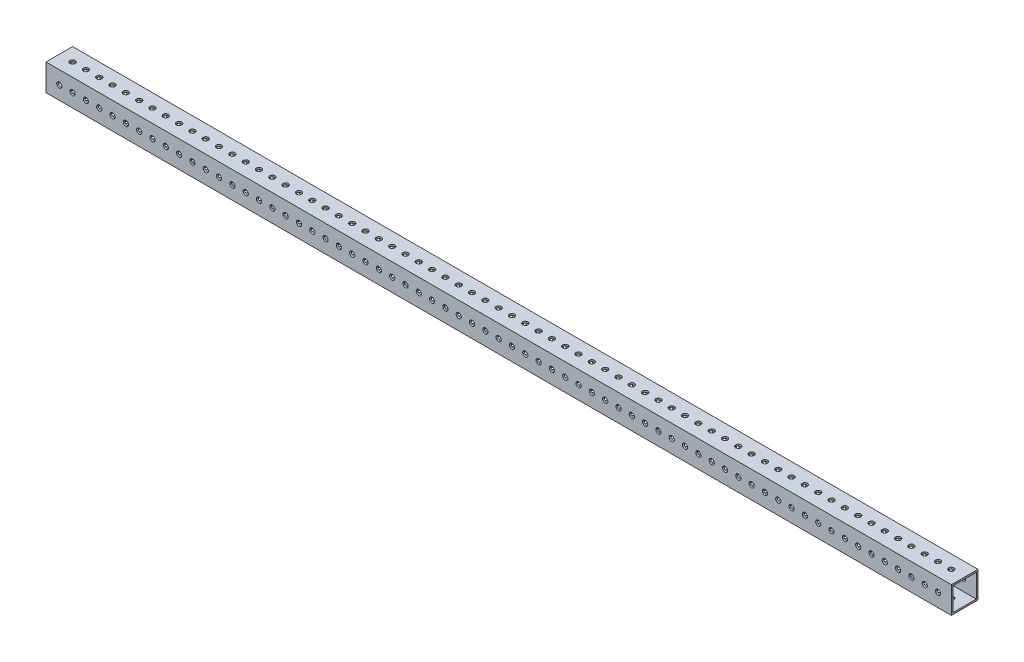
from build123d import *

# Parameters (mm, degrees)
SKETCH1_W             = 25.4
SKETCH1_H             = 25.4
SKETCH1_W_2           = 22.225
SKETCH1_H_2           = 22.225
BOSS_EXTRUDE1_DEPTH   = 431.8
SKETCH3_W             = 2.4892
SKETCH3_H             = 25.4
SKETCH3_AT_POINT_2_W  = 2.4892
SKETCH3_AT_POINT_2_H  = 25.4
LPATTERN1_START       = -12.7
LPATTERN1_OUTLINE_R   = 2.4892
LPATTERN1_DEPTH       = 25.4
LPATTERN1_2_OUTLINE_R = 2.4892
LPATTERN1_2_DEPTH     = 25.4


with BuildPart() as part:
    # Sketch1 → Boss-Extrude1 (new, symmetric)
    with BuildSketch(Plane(origin=(0, 0, 0), x_dir=(0, 0, -1), z_dir=(1, 0, 0))):
        Rectangle(SKETCH1_W, SKETCH1_H)
        Rectangle(SKETCH1_W_2, SKETCH1_H_2, mode=Mode.SUBTRACT)
    extrude(amount=BOSS_EXTRUDE1_DEPTH, both=True)

    # Sketch3 → #9 (0.196) Diameter Hole1 (revolve, cut)
    with BuildSketch(Plane(origin=(419.1, 12.7, 0), x_dir=(0, 0, 1), z_dir=(1, 0, 0))):
        with Locations((1.2446, 12.7)):
            Rectangle(SKETCH3_W, SKETCH3_H)
    revolve(axis=Axis((419.1, 19.05, 0), (0, -1, 0)), mode=Mode.SUBTRACT)

    # Sketch3 at point 2 (carried to point 2, square into its face) → #9 (0.196) Diameter Hole1 at 2 (revolve, cut)
    with BuildSketch(Plane(origin=(419.1, 0, 12.7), x_dir=(0, -1, 0), z_dir=(1, 0, 0))):
        with Locations((1.2446, 12.7)):
            Rectangle(SKETCH3_AT_POINT_2_W, SKETCH3_AT_POINT_2_H)
    revolve(axis=Axis((419.1, 0, 19.05), (0, 0, -1)), mode=Mode.SUBTRACT)

    # LPattern1: read off the stored shape, not the designer's step
    # LPattern1 outline → LPattern1 (cut)
    with BuildSketch(Plane.XY.offset(LPATTERN1_START)):
        with Locations((406.4, 0)):
            Circle(LPATTERN1_OUTLINE_R)
        with Locations((393.7, 0)):
            Circle(LPATTERN1_OUTLINE_R)
        with Locations((381, 0)):
            Circle(LPATTERN1_OUTLINE_R)
        with Locations((368.3, 0)):
            Circle(LPATTERN1_OUTLINE_R)
        with Locations((355.6, 0)):
            Circle(LPATTERN1_OUTLINE_R)
        with Locations((342.9, 0)):
            Circle(LPATTERN1_OUTLINE_R)
        with Locations((330.2, 0)):
            Circle(LPATTERN1_OUTLINE_R)
        with Locations((317.5, 0)):
            Circle(LPATTERN1_OUTLINE_R)
        with Locations((304.8, 0)):
            Circle(LPATTERN1_OUTLINE_R)
        with Locations((292.1, 0)):
            Circle(LPATTERN1_OUTLINE_R)
        with Locations((279.4, 0)):
            Circle(LPATTERN1_OUTLINE_R)
        with Locations((266.7, 0)):
            Circle(LPATTERN1_OUTLINE_R)
        with Locations((254, 0)):
            Circle(LPATTERN1_OUTLINE_R)
        with Locations((241.3, 0)):
            Circle(LPATTERN1_OUTLINE_R)
        with Locations((228.6, 0)):
            Circle(LPATTERN1_OUTLINE_R)
        with Locations((215.9, 0)):
            Circle(LPATTERN1_OUTLINE_R)
        with Locations((203.2, 0)):
            Circle(LPATTERN1_OUTLINE_R)
        with Locations((190.5, 0)):
            Circle(LPATTERN1_OUTLINE_R)
        with Locations((177.8, 0)):
            Circle(LPATTERN1_OUTLINE_R)
        with Locations((165.1, 0)):
            Circle(LPATTERN1_OUTLINE_R)
        with Locations((152.4, 0)):
            Circle(LPATTERN1_OUTLINE_R)
        with Locations((139.7, 0)):
            Circle(LPATTERN1_OUTLINE_R)
        with Locations((127, 0)):
            Circle(LPATTERN1_OUTLINE_R)
        with Locations((114.3, 0)):
            Circle(LPATTERN1_OUTLINE_R)
        with Locations((101.6, 0)):
            Circle(LPATTERN1_OUTLINE_R)
        with Locations((88.9, 0)):
            Circle(LPATTERN1_OUTLINE_R)
        with Locations((76.2, 0)):
            Circle(LPATTERN1_OUTLINE_R)
        with Locations((63.5, 0)):
            Circle(LPATTERN1_OUTLINE_R)
        with Locations((50.8, 0)):
            Circle(LPATTERN1_OUTLINE_R)
        with Locations((38.1, 0)):
            Circle(LPATTERN1_OUTLINE_R)
        with Locations((25.4, 0)):
            Circle(LPATTERN1_OUTLINE_R)
        with Locations((12.7, 0)):
            Circle(LPATTERN1_OUTLINE_R)
        Circle(LPATTERN1_OUTLINE_R)
        with Locations((-12.7, 0)):
            Circle(LPATTERN1_OUTLINE_R)
        with Locations((-25.4, 0)):
            Circle(LPATTERN1_OUTLINE_R)
        with Locations((-38.1, 0)):
            Circle(LPATTERN1_OUTLINE_R)
        with Locations((-50.8, 0)):
            Circle(LPATTERN1_OUTLINE_R)
        with Locations((-63.5, 0)):
            Circle(LPATTERN1_OUTLINE_R)
        with Locations((-76.2, 0)):
            Circle(LPATTERN1_OUTLINE_R)
        with Locations((-88.9, 0)):
            Circle(LPATTERN1_OUTLINE_R)
        with Locations((-101.6, 0)):
            Circle(LPATTERN1_OUTLINE_R)
        with Locations((-114.3, 0)):
            Circle(LPATTERN1_OUTLINE_R)
        with Locations((-127, 0)):
            Circle(LPATTERN1_OUTLINE_R)
        with Locations((-139.7, 0)):
            Circle(LPATTERN1_OUTLINE_R)
        with Locations((-152.4, 0)):
            Circle(LPATTERN1_OUTLINE_R)
        with Locations((-165.1, 0)):
            Circle(LPATTERN1_OUTLINE_R)
        with Locations((-177.8, 0)):
            Circle(LPATTERN1_OUTLINE_R)
        with Locations((-190.5, 0)):
            Circle(LPATTERN1_OUTLINE_R)
        with Locations((-203.2, 0)):
            Circle(LPATTERN1_OUTLINE_R)
        with Locations((-215.9, 0)):
            Circle(LPATTERN1_OUTLINE_R)
        with Locations((-228.6, 0)):
            Circle(LPATTERN1_OUTLINE_R)
        with Locations((-241.3, 0)):
            Circle(LPATTERN1_OUTLINE_R)
        with Locations((-254, 0)):
            Circle(LPATTERN1_OUTLINE_R)
        with Locations((-266.7, 0)):
            Circle(LPATTERN1_OUTLINE_R)
        with Locations((-279.4, 0)):
            Circle(LPATTERN1_OUTLINE_R)
        with Locations((-292.1, 0)):
            Circle(LPATTERN1_OUTLINE_R)
        with Locations((-304.8, 0)):
            Circle(LPATTERN1_OUTLINE_R)
        with Locations((-317.5, 0)):
            Circle(LPATTERN1_OUTLINE_R)
        with Locations((-330.2, 0)):
            Circle(LPATTERN1_OUTLINE_R)
        with Locations((-342.9, 0)):
            Circle(LPATTERN1_OUTLINE_R)
        with Locations((-355.6, 0)):
            Circle(LPATTERN1_OUTLINE_R)
        with Locations((-368.3, 0)):
            Circle(LPATTERN1_OUTLINE_R)
        with Locations((-381, 0)):
            Circle(LPATTERN1_OUTLINE_R)
        with Locations((-393.7, 0)):
            Circle(LPATTERN1_OUTLINE_R)
        with Locations((-406.4, 0)):
            Circle(LPATTERN1_OUTLINE_R)
        with Locations((-419.1, 0)):
            Circle(LPATTERN1_OUTLINE_R)
    extrude(amount=LPATTERN1_DEPTH, mode=Mode.SUBTRACT)

    # LPattern1 2 outline → LPattern1 2 (cut)
    with BuildSketch(Plane(origin=(0, 0, 0), x_dir=(1, 0, 0), z_dir=(0, 1, 0)).offset(LPATTERN1_START)):
        with Locations((406.4, 0)):
            Circle(LPATTERN1_2_OUTLINE_R)
        with Locations((393.7, 0)):
            Circle(LPATTERN1_2_OUTLINE_R)
        with Locations((381, 0)):
            Circle(LPATTERN1_2_OUTLINE_R)
        with Locations((368.3, 0)):
            Circle(LPATTERN1_2_OUTLINE_R)
        with Locations((355.6, 0)):
            Circle(LPATTERN1_2_OUTLINE_R)
        with Locations((342.9, 0)):
            Circle(LPATTERN1_2_OUTLINE_R)
        with Locations((330.2, 0)):
            Circle(LPATTERN1_2_OUTLINE_R)
        with Locations((317.5, 0)):
            Circle(LPATTERN1_2_OUTLINE_R)
        with Locations((304.8, 0)):
            Circle(LPATTERN1_2_OUTLINE_R)
        with Locations((292.1, 0)):
            Circle(LPATTERN1_2_OUTLINE_R)
        with Locations((279.4, 0)):
            Circle(LPATTERN1_2_OUTLINE_R)
        with Locations((266.7, 0)):
            Circle(LPATTERN1_2_OUTLINE_R)
        with Locations((254, 0)):
            Circle(LPATTERN1_2_OUTLINE_R)
        with Locations((241.3, 0)):
            Circle(LPATTERN1_2_OUTLINE_R)
        with Locations((228.6, 0)):
            Circle(LPATTERN1_2_OUTLINE_R)
        with Locations((215.9, 0)):
            Circle(LPATTERN1_2_OUTLINE_R)
        with Locations((203.2, 0)):
            Circle(LPATTERN1_2_OUTLINE_R)
        with Locations((190.5, 0)):
            Circle(LPATTERN1_2_OUTLINE_R)
        with Locations((177.8, 0)):
            Circle(LPATTERN1_2_OUTLINE_R)
        with Locations((165.1, 0)):
            Circle(LPATTERN1_2_OUTLINE_R)
        with Locations((152.4, 0)):
            Circle(LPATTERN1_2_OUTLINE_R)
        with Locations((139.7, 0)):
            Circle(LPATTERN1_2_OUTLINE_R)
        with Locations((127, 0)):
            Circle(LPATTERN1_2_OUTLINE_R)
        with Locations((114.3, 0)):
            Circle(LPATTERN1_2_OUTLINE_R)
        with Locations((101.6, 0)):
            Circle(LPATTERN1_2_OUTLINE_R)
        with Locations((88.9, 0)):
            Circle(LPATTERN1_2_OUTLINE_R)
        with Locations((76.2, 0)):
            Circle(LPATTERN1_2_OUTLINE_R)
        with Locations((63.5, 0)):
            Circle(LPATTERN1_2_OUTLINE_R)
        with Locations((50.8, 0)):
            Circle(LPATTERN1_2_OUTLINE_R)
        with Locations((38.1, 0)):
            Circle(LPATTERN1_2_OUTLINE_R)
        with Locations((25.4, 0)):
            Circle(LPATTERN1_2_OUTLINE_R)
        with Locations((12.7, 0)):
            Circle(LPATTERN1_2_OUTLINE_R)
        Circle(LPATTERN1_2_OUTLINE_R)
        with Locations((-12.7, 0)):
            Circle(LPATTERN1_2_OUTLINE_R)
        with Locations((-25.4, 0)):
            Circle(LPATTERN1_2_OUTLINE_R)
        with Locations((-38.1, 0)):
            Circle(LPATTERN1_2_OUTLINE_R)
        with Locations((-50.8, 0)):
            Circle(LPATTERN1_2_OUTLINE_R)
        with Locations((-63.5, 0)):
            Circle(LPATTERN1_2_OUTLINE_R)
        with Locations((-76.2, 0)):
            Circle(LPATTERN1_2_OUTLINE_R)
        with Locations((-88.9, 0)):
            Circle(LPATTERN1_2_OUTLINE_R)
        with Locations((-101.6, 0)):
            Circle(LPATTERN1_2_OUTLINE_R)
        with Locations((-114.3, 0)):
            Circle(LPATTERN1_2_OUTLINE_R)
        with Locations((-127, 0)):
            Circle(LPATTERN1_2_OUTLINE_R)
        with Locations((-139.7, 0)):
            Circle(LPATTERN1_2_OUTLINE_R)
        with Locations((-152.4, 0)):
            Circle(LPATTERN1_2_OUTLINE_R)
        with Locations((-165.1, 0)):
            Circle(LPATTERN1_2_OUTLINE_R)
        with Locations((-177.8, 0)):
            Circle(LPATTERN1_2_OUTLINE_R)
        with Locations((-190.5, 0)):
            Circle(LPATTERN1_2_OUTLINE_R)
        with Locations((-203.2, 0)):
            Circle(LPATTERN1_2_OUTLINE_R)
        with Locations((-215.9, 0)):
            Circle(LPATTERN1_2_OUTLINE_R)
        with Locations((-228.6, 0)):
            Circle(LPATTERN1_2_OUTLINE_R)
        with Locations((-241.3, 0)):
            Circle(LPATTERN1_2_OUTLINE_R)
        with Locations((-254, 0)):
            Circle(LPATTERN1_2_OUTLINE_R)
        with Locations((-266.7, 0)):
            Circle(LPATTERN1_2_OUTLINE_R)
        with Locations((-279.4, 0)):
            Circle(LPATTERN1_2_OUTLINE_R)
        with Locations((-292.1, 0)):
            Circle(LPATTERN1_2_OUTLINE_R)
        with Locations((-304.8, 0)):
            Circle(LPATTERN1_2_OUTLINE_R)
        with Locations((-317.5, 0)):
            Circle(LPATTERN1_2_OUTLINE_R)
        with Locations((-330.2, 0)):
            Circle(LPATTERN1_2_OUTLINE_R)
        with Locations((-342.9, 0)):
            Circle(LPATTERN1_2_OUTLINE_R)
        with Locations((-355.6, 0)):
            Circle(LPATTERN1_2_OUTLINE_R)
        with Locations((-368.3, 0)):
            Circle(LPATTERN1_2_OUTLINE_R)
        with Locations((-381, 0)):
            Circle(LPATTERN1_2_OUTLINE_R)
        with Locations((-393.7, 0)):
            Circle(LPATTERN1_2_OUTLINE_R)
        with Locations((-406.4, 0)):
            Circle(LPATTERN1_2_OUTLINE_R)
        with Locations((-419.1, 0)):
            Circle(LPATTERN1_2_OUTLINE_R)
    extrude(amount=LPATTERN1_2_DEPTH, mode=Mode.SUBTRACT)


solid = part.part
